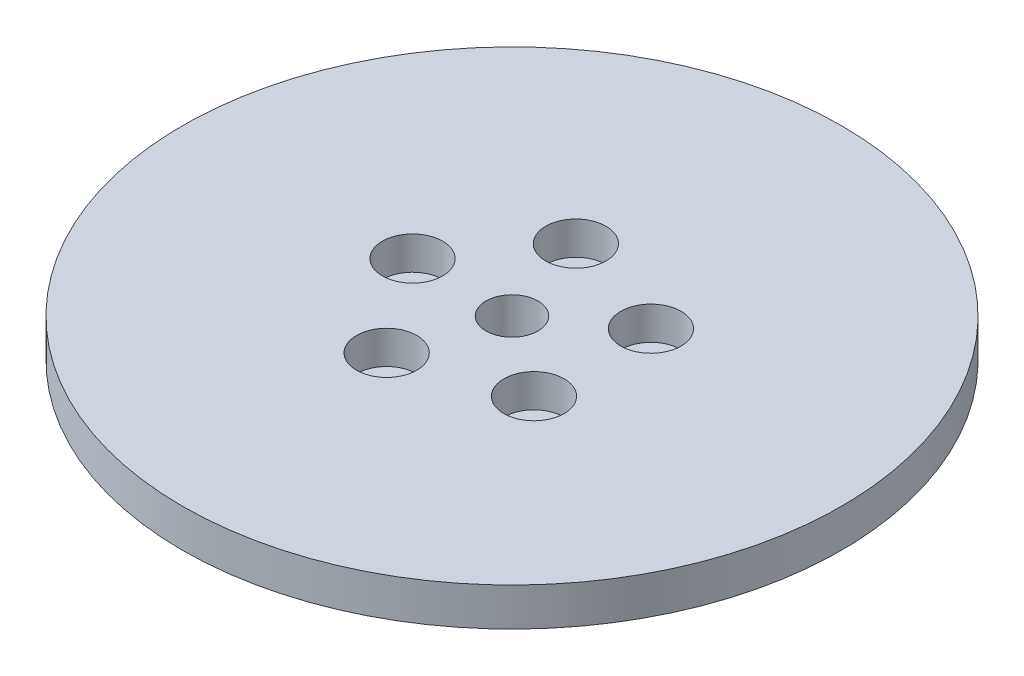
from build123d import *

# Parameters (mm, degrees)
SKETCH1_R           = 95
BOSS_EXTRUDE1_DEPTH = 11
SKETCH2_R           = 7.5
CUT_EXTRUDE1_DEPTH  = 135.799851632
SKETCH3_R           = 8.690650408
CUT_EXTRUDE2_DEPTH  = 9.558500742
CIRPATTERN1_COUNT   = 5


with BuildPart() as part:
    # Sketch1 → Boss-Extrude1 (new body)
    with BuildSketch(Plane(origin=(0, 0, 0), x_dir=(1, 0, 0), z_dir=(0, 1, 0))):
        Circle(SKETCH1_R)
    extrude(amount=BOSS_EXTRUDE1_DEPTH)

    # Sketch2 → Cut-Extrude1 (cut, through all)
    with BuildSketch(Plane(origin=(0, 0, 0), x_dir=(1, 0, 0), z_dir=(0, 1, 0))):
        Circle(SKETCH2_R)
    extrude(amount=CUT_EXTRUDE1_DEPTH, mode=Mode.SUBTRACT)

    # Sketch3 → Cut-Extrude2 (cut)
    with BuildSketch(Plane(origin=(0, 11, 0), x_dir=(1, 0, 0), z_dir=(0, 1, 0))):
        with Locations((-28.673610098, 0)):
            Circle(SKETCH3_R)
    cut_extrude2 = extrude(amount=-CUT_EXTRUDE2_DEPTH, mode=Mode.SUBTRACT)

    # CirPattern1: Cut-Extrude2 ×5 about axis
    cirpattern1_axis = Axis((0, 0, 0), (0, 1, 0))
    for i in range(1, CIRPATTERN1_COUNT):
        add(cut_extrude2.rotate(cirpattern1_axis, i * 360 / CIRPATTERN1_COUNT), mode=Mode.SUBTRACT)


solid = part.part
